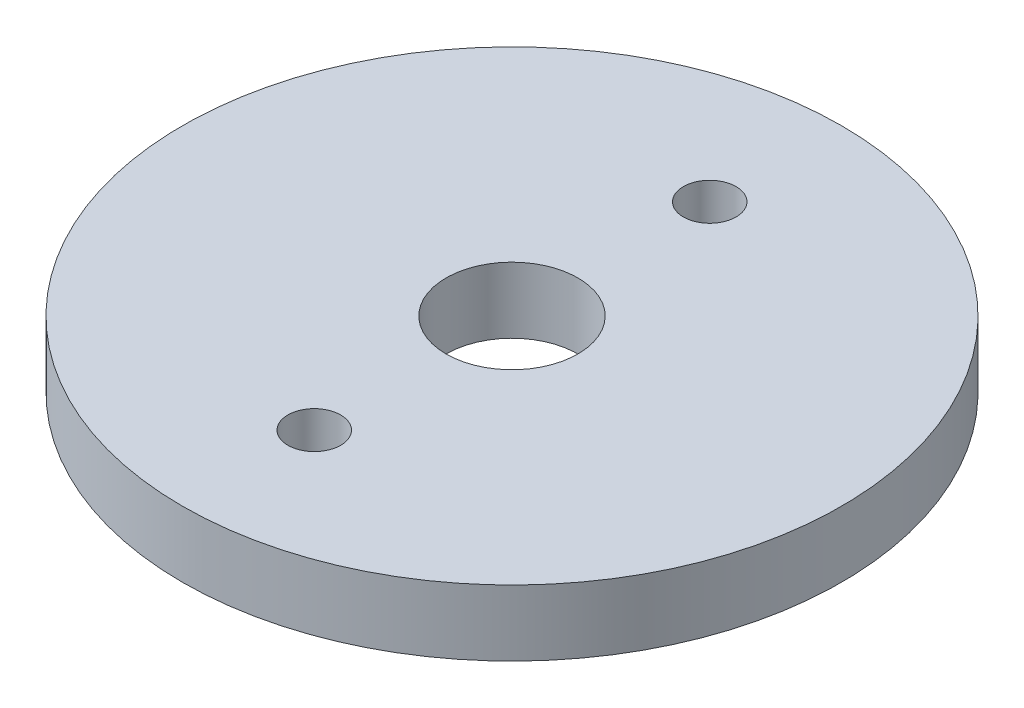
from build123d import *

# Parameters (mm, degrees)
SKETCH1_R           = 20
BOSS_EXTRUDE1_DEPTH = 4
CUT_EXTRUDE1_REACH  = 30.566
SKETCH2_R           = 4
SKETCH2_R_2         = 1.6


with BuildPart() as part:
    # Sketch1 → Boss-Extrude1 (new body)
    with BuildSketch(Plane(origin=(0, 0, 0), x_dir=(1, 0, 0), z_dir=(0, 1, 0))):
        Circle(SKETCH1_R)
    extrude(amount=BOSS_EXTRUDE1_DEPTH)

    # Sketch2 → Cut-Extrude1 (cut, up to next)
    with BuildSketch(Plane(origin=(0, 0, 0), x_dir=(1, 0, 0), z_dir=(0, 1, 0)), mode=Mode.PRIVATE) as cut_extrude1_sk1:
        Circle(SKETCH2_R)
    cut_extrude1_tool1 = extrude(cut_extrude1_sk1.sketch, amount=CUT_EXTRUDE1_REACH, mode=Mode.PRIVATE) & part.part
    # Sketch2 → Cut-Extrude1 (cut, up to next)
    with BuildSketch(Plane(origin=(0, 0, 0), x_dir=(1, 0, 0), z_dir=(0, 1, 0)), mode=Mode.PRIVATE) as cut_extrude1_sk2:
        with Locations((0, 12)):
            Circle(SKETCH2_R_2)
    cut_extrude1_tool2 = extrude(cut_extrude1_sk2.sketch, amount=CUT_EXTRUDE1_REACH, mode=Mode.PRIVATE) & part.part
    # Sketch2 → Cut-Extrude1 (cut, up to next)
    with BuildSketch(Plane(origin=(0, 0, 0), x_dir=(1, 0, 0), z_dir=(0, 1, 0)), mode=Mode.PRIVATE) as cut_extrude1_sk3:
        with Locations((0, -12)):
            Circle(SKETCH2_R_2)
    cut_extrude1_tool3 = extrude(cut_extrude1_sk3.sketch, amount=CUT_EXTRUDE1_REACH, mode=Mode.PRIVATE) & part.part
    add(cut_extrude1_tool1.solids().sort_by_distance((0, 0, 0))[0], mode=Mode.SUBTRACT)
    add(cut_extrude1_tool2.solids().sort_by_distance((0, 0, -12))[0], mode=Mode.SUBTRACT)
    add(cut_extrude1_tool3.solids().sort_by_distance((0, 0, 12))[0], mode=Mode.SUBTRACT)


solid = part.part
